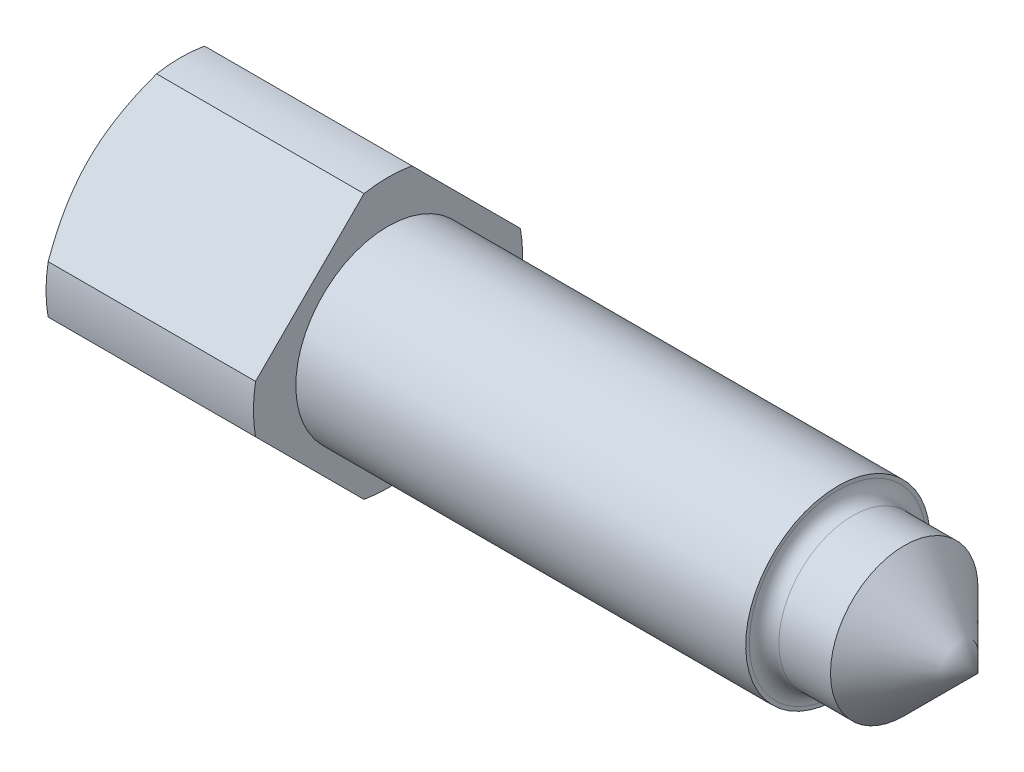
from build123d import *

# Parameters (mm, degrees)
SKETCH1_R          = 3.65
BASEHEAD_DEPTH     = 6
SKETCH2_OUTSIDE_W  = 11.688
SKETCH2_OUTSIDE_H  = 11.688
CUT_EXTRUDE1_DEPTH = 6
FILLET1_R          = 0.4


with BuildPart() as part:
    # Sketch1 → BaseHead (new body)
    with BuildSketch(Plane(origin=(0, 0, 0), x_dir=(0, 0, -1), z_dir=(1, 0, 0))):
        Circle(SKETCH1_R)
    extrude(amount=BASEHEAD_DEPTH)

    # Sketch2 outside → Cut-Extrude1 (cut)
    with BuildSketch(Plane(origin=(0, 2.662946325, -1.492108674), x_dir=(0, 0, 1), z_dir=(-1, 0, 0))):
        with Locations((1.492, -2.663)):
            Rectangle(SKETCH2_OUTSIDE_W, SKETCH2_OUTSIDE_H)
        Polygon((5.734749361, -2.662946325), (1.492108674, 1.579694362), (-2.750532013, -2.662946325), (1.492108674, -6.905587012), align=None, mode=Mode.SUBTRACT)
    extrude(amount=-CUT_EXTRUDE1_DEPTH, mode=Mode.SUBTRACT)

    # Sketch3 → Cut-Revolve1 (revolve, cut)
    with BuildSketch(Plane(origin=(1.259716749, -5.274716749, 0), x_dir=(0, -1, 0), z_dir=(0, 0, 1))):
        Polygon((-9.289716749, -1.259716749), (-8.274716749, -1.259716749), (-9.289716749, -0.673706226), align=None)
    revolve(axis=Axis((1.545283251, 0, 0), (-1, 0, 0)), mode=Mode.SUBTRACT)

    # Sketch4 → BaseBody (revolve)
    with BuildSketch(Plane(origin=(-10.34721472, 12.84721472, 0), x_dir=(0, -1, 0), z_dir=(0, 0, 1))):
        Polygon((12.84721472, 16.34721472), (15.34721472, 16.34721472), (15.34721472, 28.54721472), (14.84721472, 28.54721472), (14.84721472, 30.34721472), (12.84721472, 32.34721472), align=None)
    revolve(axis=Axis((14.086803097, 0, 0), (-1, 0, 0)))

    # Fillet1
    fillet1_edges = [part.edges().sort_by_distance(p)[0] for p in [
        (18.2, 2, 0),
    ]]
    fillet(fillet1_edges, radius=FILLET1_R)


solid = part.part
